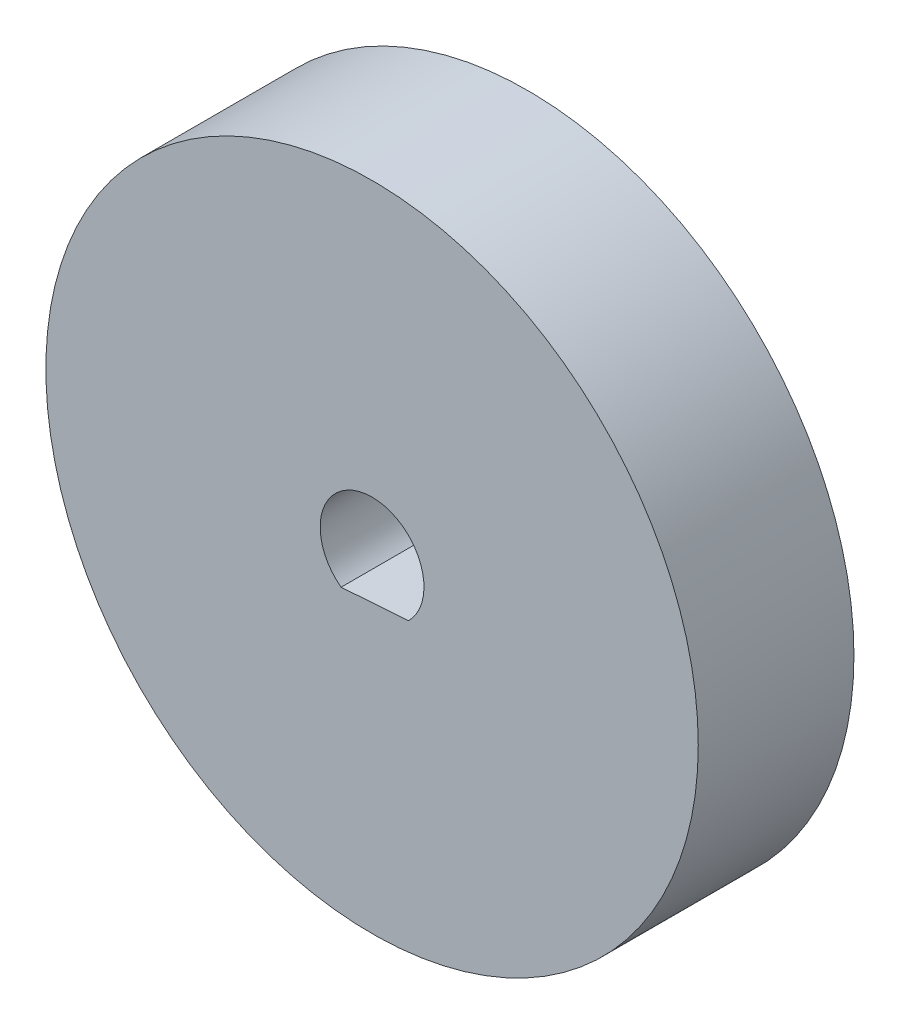
from build123d import *

# Parameters (mm, degrees)
SKETCH1_R           = 11.176
BOSS_EXTRUDE1_DEPTH = 5.334
CUT_EXTRUDE1_DEPTH  = 23.233605605


with BuildPart() as part:
    # Sketch1 → Boss-Extrude1 (new body)
    with BuildSketch(Plane.XY):
        with Locations((0, 7.2896082)):
            Circle(SKETCH1_R)
    extrude(amount=BOSS_EXTRUDE1_DEPTH)

    # Sketch2 → Cut-Extrude1 (cut, through all)
    with BuildSketch(Plane(origin=(0, 0, 0), x_dir=(-1, 0, 0), z_dir=(0, 0, -1))):
        with BuildLine():
            ThreePointArc((1.778, 7.2896082), (-0.686856501, 8.929581415), (-1.247323, 6.022537036))
            Line((-1.247323, 6.022537036), (1.06129443, 5.863095623))
            ThreePointArc((1.06129443, 5.863095623), (1.588751947, 6.491390653), (1.778, 7.2896082))
        make_face()
    extrude(amount=-CUT_EXTRUDE1_DEPTH, mode=Mode.SUBTRACT)


solid = part.part
